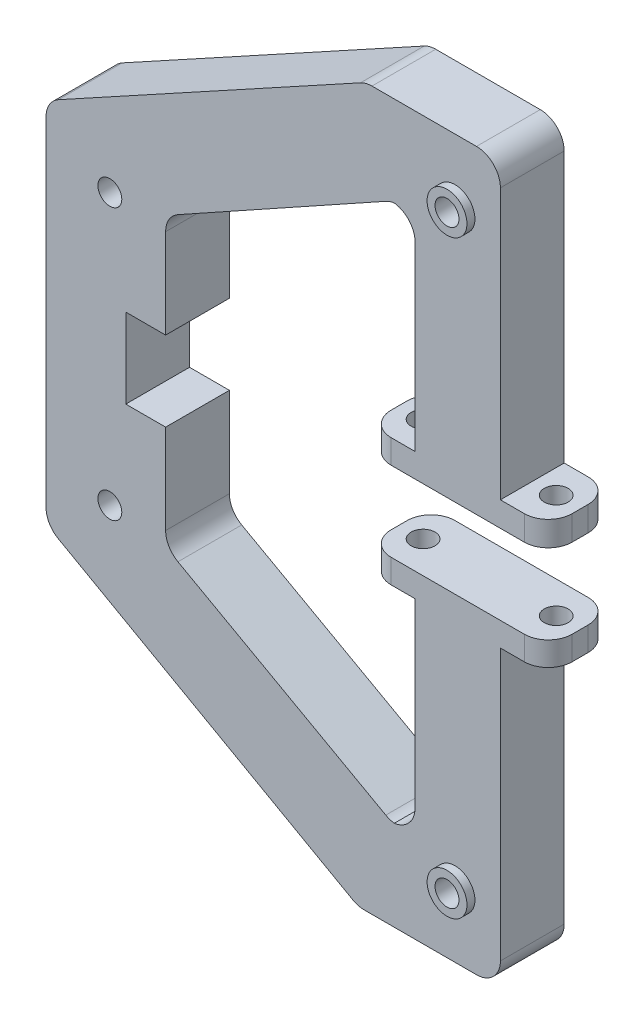
from build123d import *

# Parameters (mm, degrees)
EXTRUDE_1_DEPTH          = 8
SKETCH_2_R               = 1.5
CUT_EXTRUDE_1_DEPTH      = 84.600239234
EXTRUDE_START            = 1
SKETCH_7_R               = 2.5
SKETCH_7_R_2             = 1.5
EXTRUDE_5_DEPTH          = 1
CUT_EXTRUDE_2_DEPTH      = 10
CUT_EXTRUDE_2_DEPTH_BACK = 20
SKETCH_8_R               = 1.5
FILLET_1_R               = 3
FILLET_2_R               = 3


with BuildPart() as part:
    # 草图1 → 凸台-拉伸1 (new body)
    with BuildSketch(Plane.XY):
        Polygon((-29.882727096, 45), (-70, 23), (-70, 5), (-70, -5), (-70, -23), (-30.839658999, -45), (-13, -45), (-13, -8), (-7, -8), (-7, -5), (-13.8744125, -5), (-23.7, -5), (-29.7, -5), (-29.7, -8), (-23.7, -8), (-23.7, -33.722222222), (-26.7, -33.722222222), (-55, -18), (-55, -10), (-55, -5), (-60, -5), (-60, 5), (-55, 5), (-55, 10), (-55, 18), (-26.7, 33.722222222), (-23.7, 33.722222222), (-23.7, 8), (-29.7, 8), (-29.7, 5), (-23.7, 5), (-13.8744125, 5), (-7, 5), (-7, 8.100206116), (-13, 8.100206116), (-13, 45), (-13.841189827, 45), align=None)
    extrude(amount=EXTRUDE_1_DEPTH)

    # 草图2 → 切除-拉伸1 (cut, through all)
    with BuildSketch(Plane.XY.offset(8)):
        with Locations((-62, 17)):
            Circle(SKETCH_2_R)
        with Locations((-62, -17)):
            Circle(SKETCH_2_R)
        with Locations((-18.698729811, 37)):
            Circle(SKETCH_2_R)
        with Locations((-18.698729811, -37)):
            Circle(SKETCH_2_R)
    extrude(amount=-CUT_EXTRUDE_1_DEPTH, mode=Mode.SUBTRACT)

    # 草图7 → 凸台-拉伸5 (add)
    # profile 1 of 2: a face of its own
    with BuildSketch(Plane.XY.offset(8).offset(EXTRUDE_START)):
        with Locations((-18.698729811, 37)):
            Circle(SKETCH_7_R)
        with Locations((-18.698729811, 37)):
            Circle(SKETCH_7_R_2, mode=Mode.SUBTRACT)
    # profile 2 of 2: a face of its own
    with BuildSketch(Plane.XY.offset(8).offset(EXTRUDE_START)):
        with Locations((-18.698729811, -37)):
            Circle(SKETCH_7_R)
        with Locations((-18.698729811, -37)):
            Circle(SKETCH_7_R_2, mode=Mode.SUBTRACT)
    extrude(amount=-EXTRUDE_5_DEPTH)

    # 草图8 → 切除-拉伸2 (cut, two sides: drawn at the far end of the back side and taken through both)
    with BuildSketch(Plane(origin=(0, 8, 0), x_dir=(1, 0, 0), z_dir=(0, 1, 0)).offset(-CUT_EXTRUDE_2_DEPTH_BACK)):
        with Locations(Location((-26.7, -4, 0), (0, 0, 90))):
            Circle(SKETCH_8_R)
        with Locations(Location((-10, -4, 0), (0, 0, 90))):
            Circle(SKETCH_8_R)
    extrude(amount=CUT_EXTRUDE_2_DEPTH + CUT_EXTRUDE_2_DEPTH_BACK, mode=Mode.SUBTRACT)

    # 圆角1
    # the kernel refuses this fillet: 3 mm, written as the material it adds along each edge
    with BuildSketch(Plane(origin=(-55, -18, 0), x_dir=(0.8741572761215378, -0.4856429311786321, 0), z_dir=(0, 0, 1))) as fillet_1_piece_1:
        with BuildLine():
            CenterArc((FILLET_1_R * 0.588403348999, FILLET_1_R), FILLET_1_R, 209.054604099, 60.945395901)
            Line((-FILLET_1_R * 0.285753927123, FILLET_1_R * 0.514357068821), (0, 0))
            Line((0, 0), (FILLET_1_R * 0.588403348999, 0))
        make_face()
    extrude(amount=8)
    with BuildSketch(Plane(origin=(-55, 18, 0), x_dir=(0.8741572761215377, 0.4856429311786323, 0), z_dir=(0, 0, 1))) as fillet_1_piece_2:
        with BuildLine():
            CenterArc((FILLET_1_R * 0.588403348999, -FILLET_1_R), FILLET_1_R, 90, 60.945395901)
            Line((-FILLET_1_R * 0.285753927123, -FILLET_1_R * 0.514357068821), (0, 0))
            Line((0, 0), (FILLET_1_R * 0.588403348999, 0))
        make_face()
    extrude(amount=8)
    with BuildSketch(Plane(origin=(-26.7, -33.722222222, 0), x_dir=(1, 0, 0), z_dir=(0, 0, 1))) as fillet_1_piece_3:
        with BuildLine():
            CenterArc((FILLET_1_R * 0.259126028197, FILLET_1_R), FILLET_1_R, 240.945395901, 29.054604099)
            Line((-FILLET_1_R * 0.226516902981, FILLET_1_R * 0.125842723878), (0, 0))
            Line((0, 0), (FILLET_1_R * 0.259126028197, 0))
        make_face()
    extrude(amount=8)
    with BuildSketch(Plane(origin=(-23.7, -33.722222222, 0), x_dir=(0, 1, 0), z_dir=(0, 0, 1))) as fillet_1_piece_4:
        with BuildLine():
            CenterArc((FILLET_1_R, FILLET_1_R), FILLET_1_R, 180, 90)
            Line((0, FILLET_1_R), (0, 0))
            Line((0, 0), (FILLET_1_R, 0))
        make_face()
    extrude(amount=8)
    with BuildSketch(Plane(origin=(-26.7, 33.722222222, 0), x_dir=(1, 0, 0), z_dir=(0, 0, 1))) as fillet_1_piece_5:
        with BuildLine():
            CenterArc((FILLET_1_R * 0.259126028197, -FILLET_1_R), FILLET_1_R, 90, 29.054604099)
            Line((-FILLET_1_R * 0.226516902981, -FILLET_1_R * 0.125842723878), (0, 0))
            Line((0, 0), (FILLET_1_R * 0.259126028197, 0))
        make_face()
    extrude(amount=8)
    with BuildSketch(Plane(origin=(-23.7, 33.722222222, 0), x_dir=(0, -1, 0), z_dir=(0, 0, 1))) as fillet_1_piece_6:
        with BuildLine():
            CenterArc((FILLET_1_R, -FILLET_1_R), FILLET_1_R, 90, 90)
            Line((0, -FILLET_1_R), (0, 0))
            Line((0, 0), (FILLET_1_R, 0))
        make_face()
    extrude(amount=8)
    # the kernel refuses this fillet: 3 mm, written as the material it takes off along each edge
    with BuildSketch(Plane(origin=(-13, 45, -7.5), x_dir=(-1, 0, 0), z_dir=(0, 0, 1))) as fillet_1_2_piece_1:
        with BuildLine():
            CenterArc((FILLET_1_R, FILLET_1_R), FILLET_1_R, 180, 90)
            Line((0, FILLET_1_R), (0, 0))
            Line((0, 0), (FILLET_1_R, 0))
        make_face()
    extrude(amount=23, mode=Mode.SUBTRACT)
    with BuildSketch(Plane(origin=(-29.882727096, 45, -1.921488827), x_dir=(-0.8768105180064049, -0.48083605887385356, 0), z_dir=(0, 0, 1))) as fillet_1_2_piece_2:
        with BuildLine():
            CenterArc((FILLET_1_R * 0.256198510324, FILLET_1_R), FILLET_1_R, 241.259979418, 28.740020582)
            Line((-FILLET_1_R * 0.22463754855, FILLET_1_R * 0.123189481994), (0, 0))
            Line((0, 0), (FILLET_1_R * 0.256198510324, 0))
        make_face()
    extrude(amount=11.842977655, mode=Mode.SUBTRACT)
    with BuildSketch(Plane(origin=(-13, -45, -7.5), x_dir=(-1, 0, 0), z_dir=(0, 0, 1))) as fillet_1_2_piece_3:
        with BuildLine():
            CenterArc((FILLET_1_R, -FILLET_1_R), FILLET_1_R, 90, 90)
            Line((0, -FILLET_1_R), (0, 0))
            Line((0, 0), (FILLET_1_R, 0))
        make_face()
    extrude(amount=23, mode=Mode.SUBTRACT)
    with BuildSketch(Plane(origin=(-30.839658999, -45, -1.962479999), x_dir=(-0.8718388464587432, 0.4897928396837667, 0), z_dir=(0, 0, 1))) as fillet_1_2_piece_4:
        with BuildLine():
            CenterArc((FILLET_1_R * 0.261663999874, -FILLET_1_R), FILLET_1_R, 90, 29.326966439)
            Line((-FILLET_1_R * 0.22812883981, -FILLET_1_R * 0.128161153541), (0, 0))
            Line((0, 0), (FILLET_1_R * 0.261663999874, 0))
        make_face()
    extrude(amount=11.924959998, mode=Mode.SUBTRACT)
    with BuildSketch(Plane(origin=(-70, -23, -4.389060797), x_dir=(0, 1, 0), z_dir=(0, 0, 1))) as fillet_1_2_piece_5:
        with BuildLine():
            CenterArc((FILLET_1_R * 0.585208106279, -FILLET_1_R), FILLET_1_R, 90, 60.673033561)
            Line((-FILLET_1_R * 0.28663074018, -FILLET_1_R * 0.510207160316), (0, 0))
            Line((0, 0), (FILLET_1_R * 0.585208106279, 0))
        make_face()
    extrude(amount=16.778121594, mode=Mode.SUBTRACT)
    with BuildSketch(Plane(origin=(-70, 23, -4.440787922), x_dir=(0.8768105180064074, 0.48083605887384884, 0), z_dir=(0, 0, 1))) as fillet_1_2_piece_6:
        with BuildLine():
            CenterArc((FILLET_1_R * 0.592105056297, -FILLET_1_R), FILLET_1_R, 90, 61.259979418)
            Line((-FILLET_1_R * 0.284705461709, -FILLET_1_R * 0.519163941126), (0, 0))
            Line((0, 0), (FILLET_1_R * 0.592105056297, 0))
        make_face()
    extrude(amount=16.881575844, mode=Mode.SUBTRACT)

    # 圆角2
    fillet_2_edges = [part.edges().sort_by_distance(p)[0] for p in [
        (-29.7, 6.5, 8),
        (-7, 6.550103058, 8),
        (-7, -6.5, 8),
        (-29.7, -6.5, 8),
        (-7, 6.550103058, 0),
        (-29.7, 6.5, 0),
        (-29.7, -6.5, 0),
        (-7, -6.5, 0),
    ]]
    fillet(fillet_2_edges, radius=FILLET_2_R)


solid = part.part
